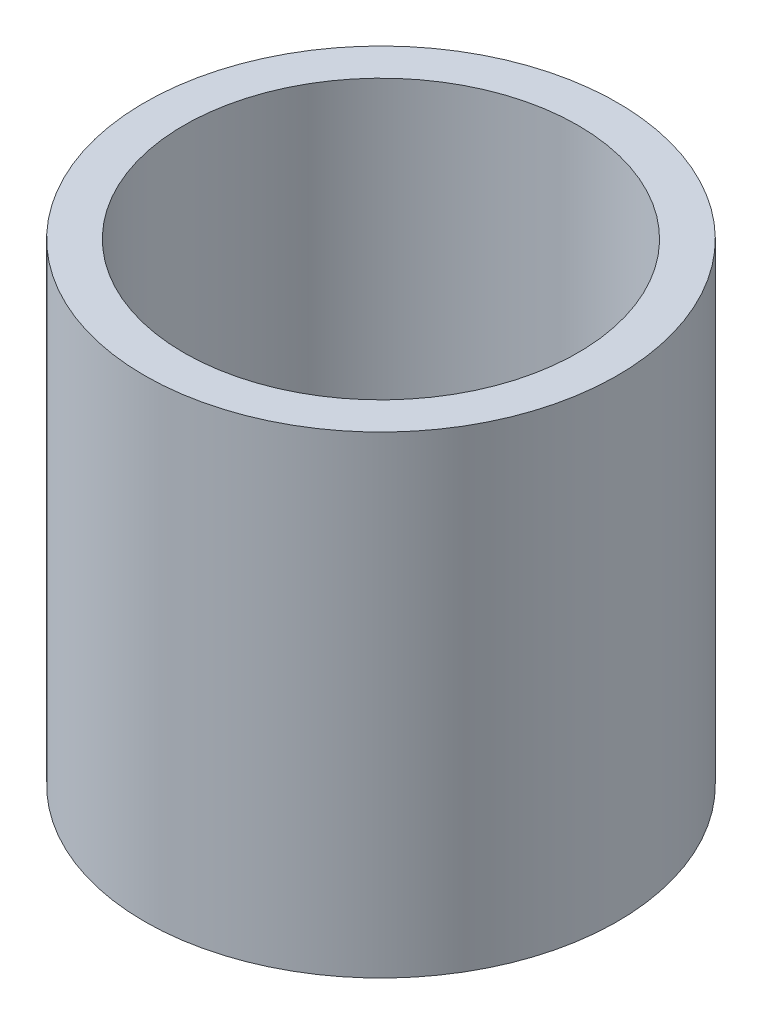
from build123d import *

# Parameters (mm, degrees)
SKETCH1_R           = 3
SKETCH1_R_2         = 2.5
BOSS_EXTRUDE1_DEPTH = 6


with BuildPart() as part:
    # Sketch1 → Boss-Extrude1 (new body)
    with BuildSketch(Plane(origin=(0, 0, 0), x_dir=(1, 0, 0), z_dir=(0, 1, 0))):
        Circle(SKETCH1_R)
        Circle(SKETCH1_R_2, mode=Mode.SUBTRACT)
    extrude(amount=BOSS_EXTRUDE1_DEPTH)


solid = part.part
